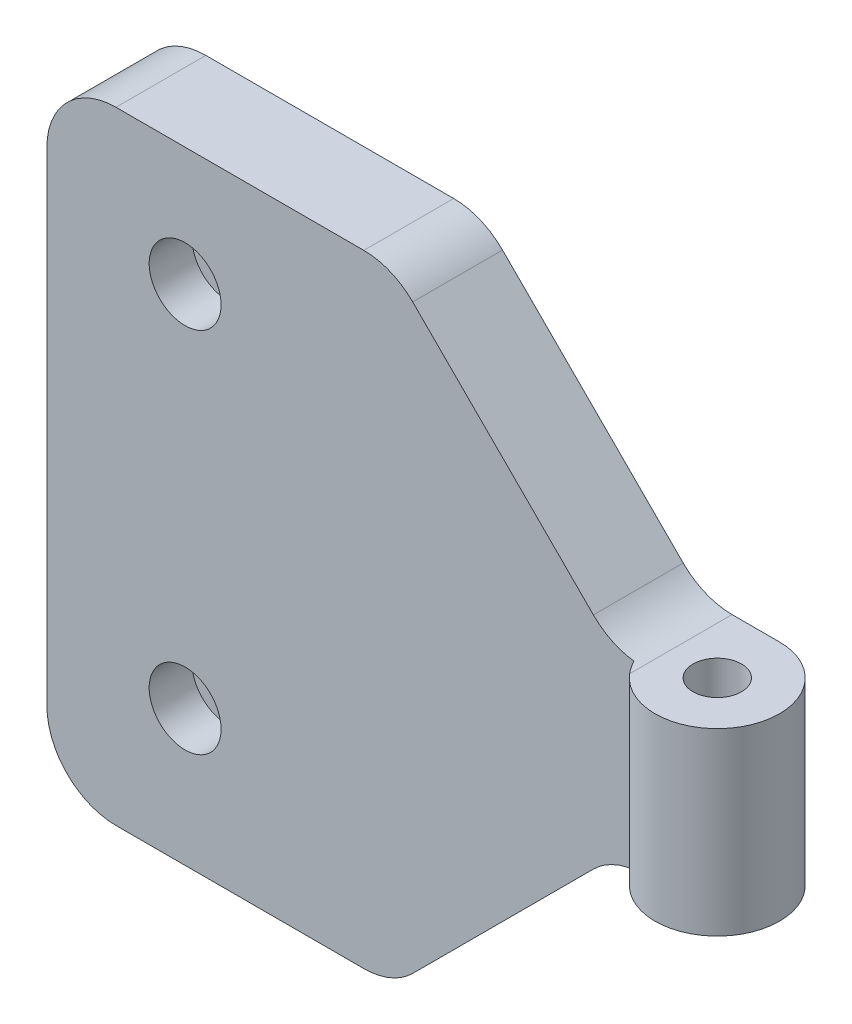
from build123d import *

# Parameters (mm, degrees)
BOSS_EXTRUDE1_DEPTH = 45
BOSS_EXTRUDE2_START = 16
SKETCH1_3_R         = 4.5
SKETCH1_3_R_2       = 1.75
BOSS_EXTRUDE2_DEPTH = 13
CUT_EXTRUDE1_START  = 16
SKETCH5_R           = 5.5
CUT_EXTRUDE1_DEPTH  = 25
SKETCH6_R           = 2.6
CUT_EXTRUDE2_DEPTH  = 15
CUT_EXTRUDE4_START  = 49.4
SKETCH5_4_R         = 5.5
CUT_EXTRUDE4_DEPTH  = 20.4
FILLET1_R           = 0.5
FILLET2_R           = 5
SKETCH7_R           = 5.5
CUT_EXTRUDE3_DEPTH  = 3
SKETCH8_R           = 3.001117943
SKETCH8_R_2         = 3.734433125
BOSS_EXTRUDE5_DEPTH = 0.4
SKETCH9_W           = 2.236067978
SKETCH9_H           = 16
CUT_EXTRUDE5_DEPTH  = 10
FILLET4_R           = 5


with BuildPart() as part:
    # Sketch1 → Boss-Extrude1 (new body)
    with BuildSketch(Plane(origin=(0, 0, 0), x_dir=(1, 0, 0), z_dir=(0, 1, 0))):
        with BuildLine():
            Line((-46.5, 4.5), (-46.5, -2))
            Line((-46.5, -2), (-4.031128874, -2))
            ThreePointArc((-4.031128874, -2), (-3.824264635, 2.371708245), (0, 4.5))
            Line((0, 4.5), (-46.5, 4.5))
        make_face()
    extrude(amount=BOSS_EXTRUDE1_DEPTH)

    # Sketch1<3> → Boss-Extrude2 (add)
    # profile 1 of 2: a face of its own
    with BuildSketch(Plane(origin=(0, 0, 0), x_dir=(1, 0, 0), z_dir=(0, 1, 0)).offset(BOSS_EXTRUDE2_START)):
        Circle(SKETCH1_3_R)
        Polygon((-2.857883832, -1.65), (0, -3.3), (2.857883832, -1.65), (2.857883832, 1.65), (0, 3.3), (-2.857883832, 1.65), align=None, mode=Mode.SUBTRACT)
    # profile 2 of 2: a face of its own
    with BuildSketch(Plane(origin=(0, 0, 0), x_dir=(1, 0, 0), z_dir=(0, 1, 0)).offset(BOSS_EXTRUDE2_START)):
        Polygon((-2.857883832, 1.65), (-2.857883832, -1.65), (0, -3.3), (2.857883832, -1.65), (2.857883832, 1.65), (0, 3.3), align=None)
        with Locations(Location((0, 0, 0), (0, 0, 90))):
            Circle(SKETCH1_3_R_2, mode=Mode.SUBTRACT)
    extrude(amount=BOSS_EXTRUDE2_DEPTH)

    # Sketch5 → Cut-Extrude1 (cut)
    with BuildSketch(Plane(origin=(0, 0, 0), x_dir=(1, 0, 0), z_dir=(0, 1, 0)).offset(CUT_EXTRUDE1_START)):
        Circle(SKETCH5_R)
    extrude(amount=-CUT_EXTRUDE1_DEPTH, mode=Mode.SUBTRACT)

    # Sketch6 → Cut-Extrude2 (cut)
    with BuildSketch(Plane.XY.offset(2)):
        with Locations((-36.5, 36.417335992)):
            Circle(SKETCH6_R)
        with Locations((-36.5, 9.832941716)):
            Circle(SKETCH6_R)
    extrude(amount=-CUT_EXTRUDE2_DEPTH, mode=Mode.SUBTRACT)

    # Sketch5<4> → Cut-Extrude4 (cut)
    with BuildSketch(Plane(origin=(0, 0, 0), x_dir=(1, 0, 0), z_dir=(0, 1, 0)).offset(CUT_EXTRUDE4_START)):
        Circle(SKETCH5_4_R)
    extrude(amount=-CUT_EXTRUDE4_DEPTH, mode=Mode.SUBTRACT)

    # Fillet1
    fillet1_edges = [part.edges().sort_by_distance(p)[0] for p in [
        (-3.16227766, 8, -4.5),
    ]]
    fillet(fillet1_edges, radius=FILLET1_R)

    # Fillet2
    fillet2_edges = [part.edges().sort_by_distance(p)[0] for p in [
        (-46.5, 45, -1.25),
        (-46.5, 0, -1.25),
    ]]
    fillet(fillet2_edges, radius=FILLET2_R)

    # Sketch7 → Cut-Extrude3 (cut)
    with BuildSketch(Plane(origin=(0, 0, -4.5), x_dir=(-1, 0, 0), z_dir=(0, 0, -1))):
        with Locations((36.5, 36.417335992)):
            Circle(SKETCH7_R)
        with Locations((36.5, 9.832941716)):
            Circle(SKETCH7_R)
    extrude(amount=-CUT_EXTRUDE3_DEPTH, mode=Mode.SUBTRACT)

    # Sketch8 → Boss-Extrude5 (add)
    with BuildSketch(Plane(origin=(0, 0, -1.5), x_dir=(-1, 0, 0), z_dir=(0, 0, -1))):
        with Locations((36.5, 36.417335992)):
            Circle(SKETCH8_R)
        with Locations((36.5, 9.832941716)):
            Circle(SKETCH8_R_2)
    extrude(amount=-BOSS_EXTRUDE5_DEPTH)

    # Sketch9 → Cut-Extrude5 (cut)
    with BuildSketch(Plane(origin=(0, 0, -4.5), x_dir=(-1, 0, 0), z_dir=(0, 0, -1))):
        Polygon((5.5, 16), (4.472135955, 16), (4.472135955, 0), (21.5, 0), align=None)
        with Locations((3.354101966, 8)):
            Rectangle(SKETCH9_W, SKETCH9_H)
        Polygon((3.16227766, 29), (3.16227766, 45), (-0.050353192, 45), (-0.050353192, 29), (0, 29), align=None)
        Polygon((5.5, 29), (21.5, 45), (3.16227766, 45), (3.16227766, 29), align=None)
    extrude(amount=-CUT_EXTRUDE5_DEPTH, mode=Mode.SUBTRACT)

    # Fillet4
    # the kernel refuses this fillet: 5 mm, written as the material it adds along each edge
    with BuildSketch(Plane(origin=(-5.5, 29, 7.17766953), x_dir=(-0.7071067811865427, 0.7071067811865525, 0), z_dir=(0, 0, -1))) as fillet4_piece_1_section:
        with BuildLine():
            CenterArc((FILLET4_R * 0.414213562373, FILLET4_R), FILLET4_R, 225, 45)
            Line((-FILLET4_R * 0.292893218813, FILLET4_R * 0.292893218813), (0, 0))
            Line((0, 0), (FILLET4_R * 0.414213562373, 0))
        make_face()
    fillet4_piece_1 = extrude(amount=16.855339059, mode=Mode.PRIVATE)
    fillet4_piece_1 = fillet4_piece_1 & Plane(origin=(0, 29.007513744, 0), x_dir=(1, 0, 0), z_dir=(0, -1, 0)) * Cylinder(4.5, 42, mode=Mode.PRIVATE)
    add(fillet4_piece_1)
    with BuildSketch(Plane(origin=(-5.5, 29, 2), x_dir=(-0.7071067811865431, 0.7071067811865518, 0), z_dir=(0, 0, -1)), Plane(origin=(-5.5, 16, 2), x_dir=(1, 0, 0), z_dir=(0, 0, -1))) as fillet4_piece_2:
        with BuildLine():
            CenterArc((FILLET4_R * 0.414213562373, FILLET4_R), FILLET4_R, 225, 45)
            Line((-FILLET4_R * 0.292893218813, FILLET4_R * 0.292893218813), (0, 0))
            Line((0, 0), (FILLET4_R * 0.414213562373, 0))
        make_face()
    extrude(amount=6.5)
    with BuildSketch(Plane(origin=(-5.5, 16, 7.17766953), x_dir=(1, 0, 0), z_dir=(0, 0, -1))) as fillet4_piece_3_section:
        with BuildLine():
            CenterArc((FILLET4_R * 0.414213562373, FILLET4_R), FILLET4_R, 225, 45)
            Line((-FILLET4_R * 0.292893218813, FILLET4_R * 0.292893218813), (0, 0))
            Line((0, 0), (FILLET4_R * 0.414213562373, 0))
        make_face()
    fillet4_piece_3 = extrude(amount=16.855339059, mode=Mode.PRIVATE)
    fillet4_piece_3 = fillet4_piece_3 & Plane(origin=(0, 15.992486256, 0), x_dir=(1, 0, 0), z_dir=(0, -1, 0)) * Cylinder(4.5, 42, mode=Mode.PRIVATE)
    add(fillet4_piece_3)
    # the kernel refuses this fillet: 5 mm, written as the material it takes off along each edge
    with BuildSketch(Plane(origin=(-21.5, 0, -9.67766953), x_dir=(0.7071067811865441, 0.7071067811865509, 0), z_dir=(0, 0, 1)), Plane(origin=(-21.5, 45, -9.67766953), x_dir=(-1, 0, 0), z_dir=(0, 0, 1))) as fillet4_2_piece_1:
        with BuildLine():
            CenterArc((FILLET4_R * 0.414213562373, FILLET4_R), FILLET4_R, 225, 45)
            Line((-FILLET4_R * 0.292893218813, FILLET4_R * 0.292893218813), (0, 0))
            Line((0, 0), (FILLET4_R * 0.414213562373, 0))
        make_face()
    extrude(amount=16.855339059, mode=Mode.SUBTRACT)


solid = part.part
